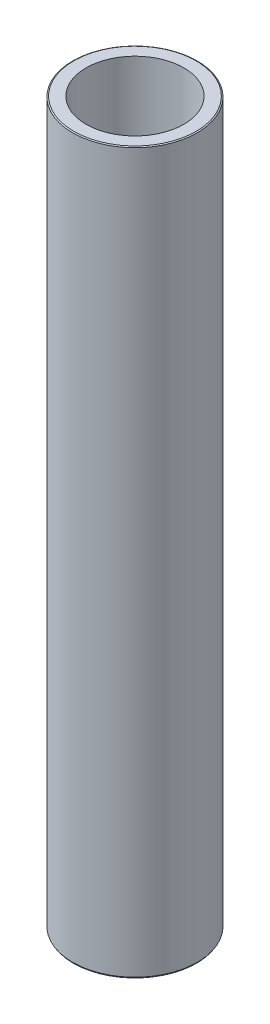
from build123d import *
from OCP.BRepFilletAPI import BRepFilletAPI_MakeChamfer

# Parameters (mm, degrees)
SKETCH1_R           = 42.5
BOSS_EXTRUDE1_DEPTH = 491.346406299
SKETCH2_R           = 33.369210479
CUT_EXTRUDE1_DEPTH  = 496.008879701
CHAMFER1_SIZE       = 0.462023814
CHAMFER1_SIZE2      = 0.80024872


with BuildPart() as part:
    # Sketch1 → Boss-Extrude1 (new body)
    with BuildSketch(Plane(origin=(0, 0, 0), x_dir=(1, 0, 0), z_dir=(0, 1, 0))):
        Circle(SKETCH1_R)
    extrude(amount=BOSS_EXTRUDE1_DEPTH)

    # Sketch2 → Cut-Extrude1 (cut, through all)
    with BuildSketch(Plane(origin=(0, 0, 0), x_dir=(1, 0, 0), z_dir=(0, 1, 0))):
        Circle(SKETCH2_R)
    extrude(amount=CUT_EXTRUDE1_DEPTH, mode=Mode.SUBTRACT)

    # Chamfer1: one chamfer whose edges measure the first distance from different faces: ONE call of the kernel's chamfer builder (chamfer() names one face for all edges)
    chamfer1_edges_1 = [part.edges().sort_by_distance(p)[0] for p in [
        (-42.5, 491.346406299, 0),
    ]]
    chamfer1_side_1 = [part.faces().sort_by_distance(p)[0] for p in [
        (-42.5, 245.673203149, 0),
    ]]
    chamfer1_edges_2 = [part.edges().sort_by_distance(p)[0] for p in [
        (-42.5, 0, 0),
    ]]
    chamfer1_side_2 = [part.faces().sort_by_distance(p)[0] for p in [
        (-41.297918472, 0, 0),
    ]]
    chamfer1 = BRepFilletAPI_MakeChamfer(part.part.solid().wrapped)
    for e in chamfer1_edges_1:
        chamfer1.Add(CHAMFER1_SIZE, CHAMFER1_SIZE2, e.wrapped, chamfer1_side_1[0].wrapped)  # the first distance lies on this face
    for e in chamfer1_edges_2:
        chamfer1.Add(CHAMFER1_SIZE, CHAMFER1_SIZE2, e.wrapped, chamfer1_side_2[0].wrapped)  # the first distance lies on this face
    add(Compound.cast(chamfer1.Shape()), mode=Mode.REPLACE)


solid = part.part
